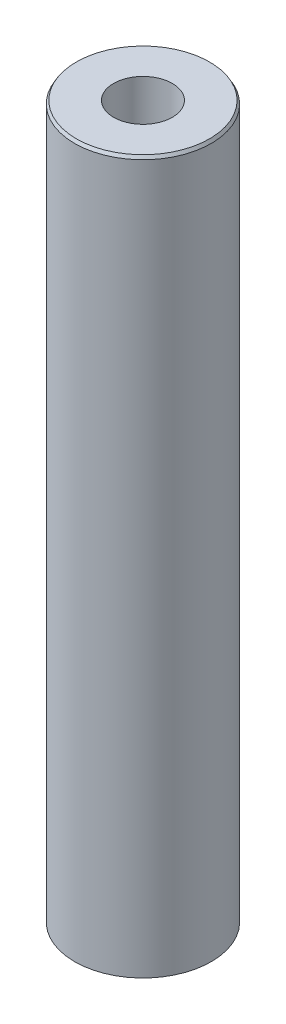
from build123d import *
from OCP.BRepFilletAPI import BRepFilletAPI_MakeChamfer

# Parameters (mm, degrees)
SKETCH1_R           = 57.5
BOSS_EXTRUDE1_DEPTH = 600
SKETCH2_R           = 24.693762822
CUT_EXTRUDE1_DEPTH  = 606.485342515
CHAMFER1_SIZE       = 2.604428628
CHAMFER1_SIZE2      = 1.503667569


with BuildPart() as part:
    # Sketch1 → Boss-Extrude1 (new body)
    with BuildSketch(Plane(origin=(0, 0, 0), x_dir=(1, 0, 0), z_dir=(0, 1, 0))):
        Circle(SKETCH1_R)
    extrude(amount=BOSS_EXTRUDE1_DEPTH)

    # Sketch2 → Cut-Extrude1 (cut, through all)
    with BuildSketch(Plane(origin=(0, 0, 0), x_dir=(1, 0, 0), z_dir=(0, 1, 0))):
        Circle(SKETCH2_R)
    extrude(amount=CUT_EXTRUDE1_DEPTH, mode=Mode.SUBTRACT)

    # Chamfer1: one chamfer whose edges measure the first distance from different faces: ONE call of the kernel's chamfer builder (chamfer() names one face for all edges)
    chamfer1_edges_1 = [part.edges().sort_by_distance(p)[0] for p in [
        (-57.5, 600, 0),
    ]]
    chamfer1_side_1 = [part.faces().sort_by_distance(p)[0] for p in [
        (-57.5, 300, 0),
    ]]
    chamfer1_edges_2 = [part.edges().sort_by_distance(p)[0] for p in [
        (-57.5, 0, 0),
    ]]
    chamfer1_side_2 = [part.faces().sort_by_distance(p)[0] for p in [
        (-55.873654403, 0, 0),
    ]]
    chamfer1 = BRepFilletAPI_MakeChamfer(part.part.solid().wrapped)
    for e in chamfer1_edges_1:
        chamfer1.Add(CHAMFER1_SIZE, CHAMFER1_SIZE2, e.wrapped, chamfer1_side_1[0].wrapped)  # the first distance lies on this face
    for e in chamfer1_edges_2:
        chamfer1.Add(CHAMFER1_SIZE, CHAMFER1_SIZE2, e.wrapped, chamfer1_side_2[0].wrapped)  # the first distance lies on this face
    add(Compound.cast(chamfer1.Shape()), mode=Mode.REPLACE)


solid = part.part
